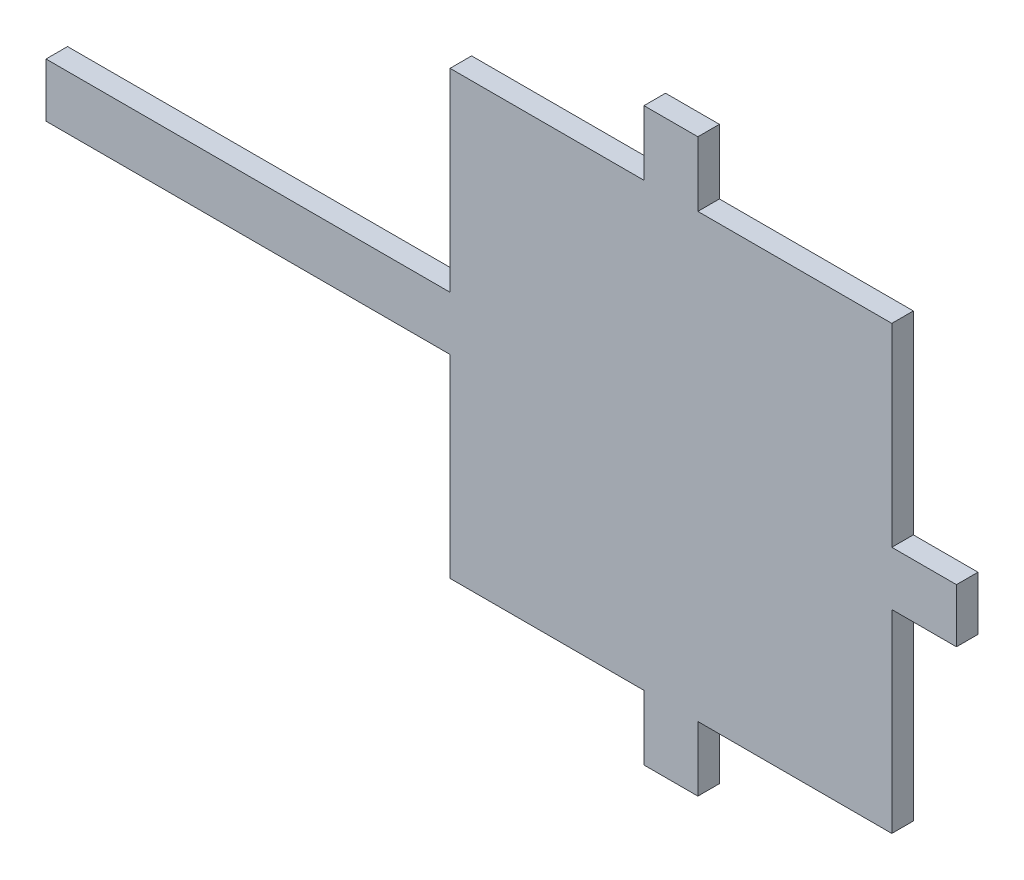
from build123d import *

# Parameters (mm, degrees)
SKETCH1_W           = 82
SKETCH1_H           = 82
BOSS_EXTRUDE3_DEPTH = 4
SKETCH6_W           = 10
SKETCH6_H           = 4
BOSS_EXTRUDE4_DEPTH = 12
CIRPATTERN1_COUNT   = 3
CIRPATTERN1_ANGLE   = 180
SKETCH8_W           = 4
SKETCH8_H           = 10
BOSS_EXTRUDE5_DEPTH = 75


with BuildPart() as part:
    # Sketch1 → Boss-Extrude3 (new body)
    with BuildSketch(Plane.XY):
        Rectangle(SKETCH1_W, SKETCH1_H)
    extrude(amount=BOSS_EXTRUDE3_DEPTH)

    # Sketch6 → Boss-Extrude4 (add)
    with BuildSketch(Plane(origin=(0, 41, 0), x_dir=(1, 0, 0), z_dir=(0, 1, 0))):
        with Locations((0, -2)):
            Rectangle(SKETCH6_W, SKETCH6_H)
    boss_extrude4 = extrude(amount=BOSS_EXTRUDE4_DEPTH)

    # CirPattern1: Boss-Extrude4 ×3 about axis
    cirpattern1_axis = Axis((0, 0, 4.2), (0, 0, -1))
    for i in range(1, CIRPATTERN1_COUNT):
        add(boss_extrude4.rotate(cirpattern1_axis, i * CIRPATTERN1_ANGLE / (CIRPATTERN1_COUNT - 1)))

    # Sketch8 → Boss-Extrude5 (add)
    with BuildSketch(Plane.ZY.offset(41)):
        with Locations((2, 0)):
            Rectangle(SKETCH8_W, SKETCH8_H)
    extrude(amount=BOSS_EXTRUDE5_DEPTH)


solid = part.part
